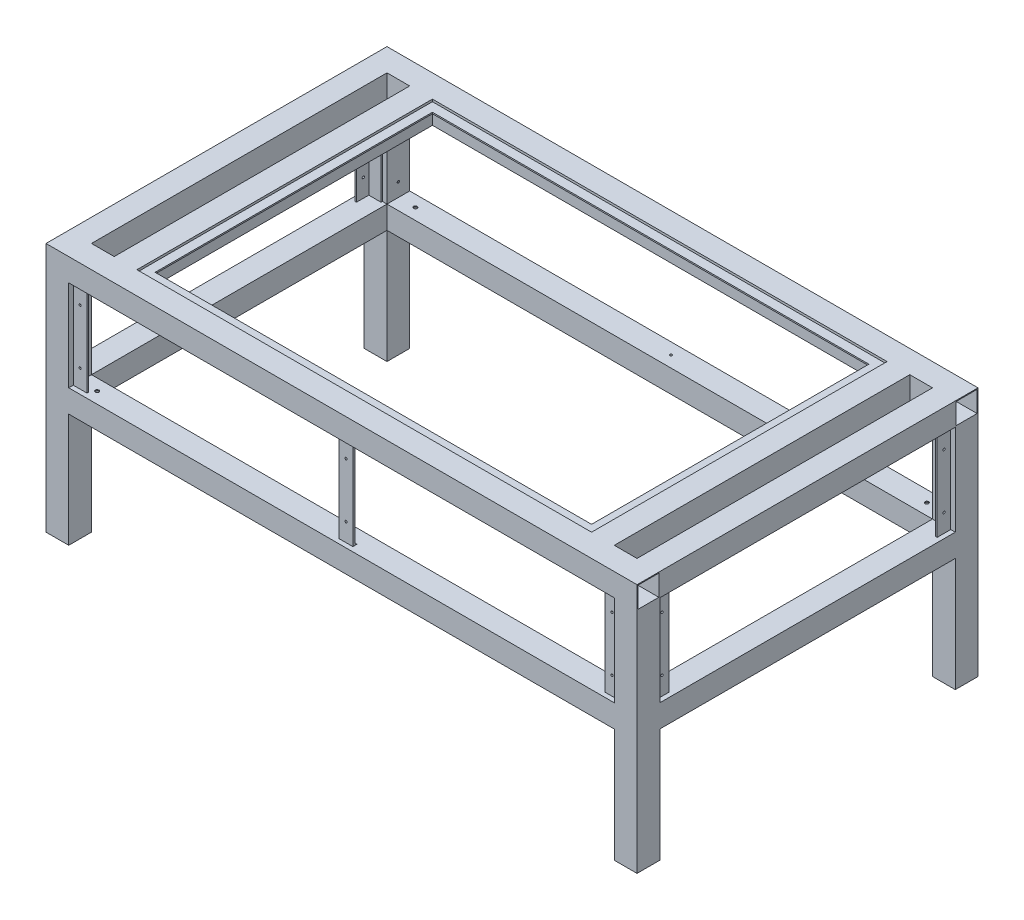
from build123d import *

# Parameters (mm, degrees)
ESQUISSE1_W               = 1300
ESQUISSE1_H               = 750
ESQUISSE1_W_2             = 1200
ESQUISSE1_H_2             = 650
BOSS_EXTRU_1_DEPTH        = 550
ESQUISSE2_W               = 1200
ESQUISSE2_H               = 200
ESQUISSE2_H_2             = 250
ENL_V_MAT_EXTRU_1_DEPTH   = 1599.436736315
ESQUISSE3_W               = 650
ESQUISSE3_H               = 200
ESQUISSE3_H_2             = 250
ENL_V_MAT_EXTRU_2_DEPTH   = 1599.436736315
ESQUISSE4_W               = 50
ESQUISSE4_H               = 650
BOSS_EXTRU_2_DEPTH        = 50
BOSS_EXTRU_2_2_DEPTH      = 50
ESQUISSE18_R              = 4
ENL_V_MAT_EXTRU_5_DEPTH   = 80
ESQUISSE19_R              = 15
ENL_V_MAT_EXTRU_6_DEPTH   = 48
ESQUISSE20_W              = 46
ESQUISSE20_H              = 46
ENL_V_MAT_EXTRU_7_DEPTH   = 10000
ESQUISSE21_W              = 46
ESQUISSE21_H              = 46
ENL_V_MAT_EXTRU_8_DEPTH   = 500
ESQUISSE22_W              = 30
ESQUISSE22_H              = 200
BOSS_EXTRU_11_DEPTH       = 3
ESQUISSE23_W              = 30
ESQUISSE23_H              = 200
ESQUISSE23_R              = 2.5
BOSS_EXTRU_12_DEPTH       = 3
SYM_TRIE2_COPY_1_SKETCH_W = 30
SYM_TRIE2_COPY_1_SKETCH_H = 200
SYM_TRIE2_COPY_1_DEPTH    = 3
SYM_TRIE2_COPY_2_SKETCH_W = 30
SYM_TRIE2_COPY_2_SKETCH_H = 200
SYM_TRIE2_COPY_2_SKETCH_R = 2.5
SYM_TRIE2_COPY_2_DEPTH    = 3
SYM_TRIE2_COPY_3_SKETCH_W = 30
SYM_TRIE2_COPY_3_SKETCH_H = 200
SYM_TRIE2_COPY_3_DEPTH    = 3
SYM_TRIE2_COPY_4_SKETCH_W = 30
SYM_TRIE2_COPY_4_SKETCH_H = 200
SYM_TRIE2_COPY_4_SKETCH_R = 2.5
SYM_TRIE2_COPY_4_DEPTH    = 3
ESQUISSE25_W              = 1000
ESQUISSE25_H              = 20
BOSS_EXTRU_14_DEPTH       = 3
ESQUISSE26_W              = 1000
ESQUISSE26_H              = 20
BOSS_EXTRU_15_DEPTH       = 3
ESQUISSE27_W              = 650
ESQUISSE27_H              = 20
BOSS_EXTRU_16_DEPTH       = 3
ESQUISSE28_W              = 20
ESQUISSE28_H              = 650
BOSS_EXTRU_17_DEPTH       = 3
SYM_TRIE8_COPY_1_SKETCH_W = 30
SYM_TRIE8_COPY_1_SKETCH_H = 200
SYM_TRIE8_COPY_1_DEPTH    = 3
SYM_TRIE8_COPY_2_SKETCH_W = 30
SYM_TRIE8_COPY_2_SKETCH_H = 200
SYM_TRIE8_COPY_2_SKETCH_R = 2.5
SYM_TRIE8_COPY_2_DEPTH    = 3
SYM_TRIE8_COPY_3_SKETCH_W = 30
SYM_TRIE8_COPY_3_SKETCH_H = 200
SYM_TRIE8_COPY_3_DEPTH    = 3
SYM_TRIE8_COPY_4_SKETCH_W = 30
SYM_TRIE8_COPY_4_SKETCH_H = 200
SYM_TRIE8_COPY_4_SKETCH_R = 2.5
SYM_TRIE8_COPY_4_DEPTH    = 3
ESQUISSE29_R              = 2.5
ENL_V_MAT_EXTRU_9_DEPTH   = 10
ESQUISSE30_R              = 2.5
ENL_V_MAT_EXTRU_10_DEPTH  = 15
ESQUISSE31_W              = 30
ESQUISSE31_H              = 5
BOSS_EXTRU_18_DEPTH       = 200
CONG_1_R                  = 5
ESQUISSE32_R              = 2.5
ENL_V_MAT_EXTRU_11_DEPTH  = 5


with BuildPart() as part:
    # Esquisse1 → Boss.-Extru.1 (new body)
    with BuildSketch(Plane(origin=(0, 0, 0), x_dir=(1, 0, 0), z_dir=(0, 1, 0))):
        with Locations((650, 375)):
            Rectangle(ESQUISSE1_W, ESQUISSE1_H)
        with Locations((650, 375)):
            Rectangle(ESQUISSE1_W_2, ESQUISSE1_H_2, mode=Mode.SUBTRACT)
    extrude(amount=-BOSS_EXTRU_1_DEPTH)

    # Esquisse2 → Enlèv. mat.-Extru.1 (cut, through all)
    with BuildSketch(Plane.XY):
        with Locations((650, -150)):
            Rectangle(ESQUISSE2_W, ESQUISSE2_H)
        with Locations((650, -425)):
            Rectangle(ESQUISSE2_W, ESQUISSE2_H_2)
    extrude(amount=-ENL_V_MAT_EXTRU_1_DEPTH, mode=Mode.SUBTRACT)

    # Esquisse3 → Enlèv. mat.-Extru.2 (cut, through all)
    with BuildSketch(Plane.ZY):
        with Locations((-375, -150)):
            Rectangle(ESQUISSE3_W, ESQUISSE3_H)
        with Locations((-375, -425)):
            Rectangle(ESQUISSE3_W, ESQUISSE3_H_2)
    extrude(amount=-ENL_V_MAT_EXTRU_2_DEPTH, mode=Mode.SUBTRACT)

    # Esquisse18 → Enlèv. mat.-Extru.5 (cut)
    with BuildSketch(Plane(origin=(0, -250, 0), x_dir=(1, 0, 0), z_dir=(0, 1, 0))):
        with Locations((1212.5, 25)):
            Circle(ESQUISSE18_R)
        with Locations((87.5, 25)):
            Circle(ESQUISSE18_R)
        with Locations((87.5, 725)):
            Circle(ESQUISSE18_R)
        with Locations((1212.5, 725)):
            Circle(ESQUISSE18_R)
    extrude(amount=-ENL_V_MAT_EXTRU_5_DEPTH, mode=Mode.SUBTRACT)

    # Esquisse19 → Enlèv. mat.-Extru.6 (cut)
    with BuildSketch(Plane(origin=(0, -300, 0), x_dir=(-1, 0, 0), z_dir=(0, -1, 0))):
        with Locations((-1212.5, 725)):
            Circle(ESQUISSE19_R)
        with Locations((-87.5, 725)):
            Circle(ESQUISSE19_R)
        with Locations((-87.5, 25)):
            Circle(ESQUISSE19_R)
        with Locations((-1212.5, 25)):
            Circle(ESQUISSE19_R)
    extrude(amount=-ENL_V_MAT_EXTRU_6_DEPTH, mode=Mode.SUBTRACT)

    # Esquisse20 → Enlèv. mat.-Extru.7 (cut)
    with BuildSketch(Plane.ZY):
        with Locations((-25, -25)):
            Rectangle(ESQUISSE20_W, ESQUISSE20_H)
        with Locations((-725, -25)):
            Rectangle(ESQUISSE20_W, ESQUISSE20_H)
    extrude(amount=-ENL_V_MAT_EXTRU_7_DEPTH, mode=Mode.SUBTRACT)

    # Esquisse21 → Enlèv. mat.-Extru.8 (cut)
    with BuildSketch(Plane(origin=(0, -550, 0), x_dir=(-1, 0, 0), z_dir=(0, -1, 0))):
        with Locations((-1275, 25)):
            Rectangle(ESQUISSE21_W, ESQUISSE21_H)
        with Locations((-1275, 725)):
            Rectangle(ESQUISSE21_W, ESQUISSE21_H)
        with Locations((-25, 725)):
            Rectangle(ESQUISSE21_W, ESQUISSE21_H)
        with Locations((-25, 25)):
            Rectangle(ESQUISSE21_W, ESQUISSE21_H)
    extrude(amount=-ENL_V_MAT_EXTRU_8_DEPTH, mode=Mode.SUBTRACT)

    # Esquisse22 → Boss.-Extru.11 (add)
    with BuildSketch(Plane(origin=(0, 0, -50), x_dir=(-1, 0, 0), z_dir=(0, 0, -1))):
        with Locations((-25, -150)):
            Rectangle(ESQUISSE22_W, ESQUISSE22_H)
    boss_extru_11 = extrude(amount=BOSS_EXTRU_11_DEPTH)

    # Esquisse23 → Boss.-Extru.12 (add)
    with BuildSketch(Plane.ZY.offset(-10)):
        with Locations((-65, -150)):
            Rectangle(ESQUISSE23_W, ESQUISSE23_H)
        with Locations((-65, -90)):
            Circle(ESQUISSE23_R, mode=Mode.SUBTRACT)
        with Locations((-65, -210)):
            Circle(ESQUISSE23_R, mode=Mode.SUBTRACT)
    boss_extru_12 = extrude(amount=-BOSS_EXTRU_12_DEPTH)

    # Symétrie1: Boss.-Extru.11, Boss.-Extru.12 across plane
    add(boss_extru_11.mirror(Plane.XY.offset(-375)))
    add(boss_extru_12.mirror(Plane.XY.offset(-375)))

    # Symétrie2 copy 1 sketch → Symétrie2 copy 1 (add)
    with BuildSketch(Plane(origin=(1300, 0, -700), x_dir=(1, 0, 0), z_dir=(0, 0, 1))):
        with Locations((-25, -150)):
            Rectangle(SYM_TRIE2_COPY_1_SKETCH_W, SYM_TRIE2_COPY_1_SKETCH_H)
    extrude(amount=SYM_TRIE2_COPY_1_DEPTH)

    # Symétrie2 copy 2 sketch → Symétrie2 copy 2 (add)
    with BuildSketch(Plane(origin=(1290, 0, -750), x_dir=(0, 0, -1), z_dir=(1, 0, 0))):
        with Locations((-65, -150)):
            Rectangle(SYM_TRIE2_COPY_2_SKETCH_W, SYM_TRIE2_COPY_2_SKETCH_H)
        with Locations((-65, -90)):
            Circle(SYM_TRIE2_COPY_2_SKETCH_R, mode=Mode.SUBTRACT)
        with Locations((-65, -210)):
            Circle(SYM_TRIE2_COPY_2_SKETCH_R, mode=Mode.SUBTRACT)
    extrude(amount=-SYM_TRIE2_COPY_2_DEPTH)

    # Symétrie2 copy 3 sketch → Symétrie2 copy 3 (add)
    with BuildSketch(Plane(origin=(1300, 0, -50), x_dir=(1, 0, 0), z_dir=(0, 0, -1))):
        with Locations((-25, 150)):
            Rectangle(SYM_TRIE2_COPY_3_SKETCH_W, SYM_TRIE2_COPY_3_SKETCH_H)
    extrude(amount=SYM_TRIE2_COPY_3_DEPTH)

    # Symétrie2 copy 4 sketch → Symétrie2 copy 4 (add)
    with BuildSketch(Plane(origin=(1290, 0, 0), x_dir=(0, 0, 1), z_dir=(1, 0, 0))):
        with Locations((-65, 150)):
            Rectangle(SYM_TRIE2_COPY_4_SKETCH_W, SYM_TRIE2_COPY_4_SKETCH_H)
        with Locations((-65, 90)):
            Circle(SYM_TRIE2_COPY_4_SKETCH_R, mode=Mode.SUBTRACT)
        with Locations((-65, 210)):
            Circle(SYM_TRIE2_COPY_4_SKETCH_R, mode=Mode.SUBTRACT)
    extrude(amount=-SYM_TRIE2_COPY_4_DEPTH)

    # Symétrie3: Boss.-Extru.11, Boss.-Extru.12 across plane
    add(boss_extru_11.mirror(Plane(origin=(0, 0, 0), x_dir=(-0.7071067811865475, 0, 0.7071067811865477), z_dir=(-0.7071067811865476, 0, -0.7071067811865475))))
    add(boss_extru_12.mirror(Plane(origin=(0, 0, 0), x_dir=(-0.7071067811865475, 0, 0.7071067811865477), z_dir=(-0.7071067811865476, 0, -0.7071067811865475))))



with BuildPart() as body_2:
    # Esquisse4 → Boss.-Extru.2 (new body)
    with BuildSketch(Plane(origin=(0, 0, 0), x_dir=(1, 0, 0), z_dir=(0, 1, 0))):
        with Locations((125, 375)):
            Rectangle(ESQUISSE4_W, ESQUISSE4_H)
    extrude(amount=-BOSS_EXTRU_2_DEPTH)


with BuildPart() as body_3:
    # Esquisse4 → Boss.-Extru.2 2 (new body)
    with BuildSketch(Plane(origin=(0, 0, 0), x_dir=(1, 0, 0), z_dir=(0, 1, 0))):
        with Locations((1175, 375)):
            Rectangle(ESQUISSE4_W, ESQUISSE4_H)
    extrude(amount=-BOSS_EXTRU_2_2_DEPTH)


with BuildPart() as part_1:
    add(part.part)

    add(body_2.part)  # Boss.-Extru.14 merges body 2

    add(body_3.part)  # Boss.-Extru.14 merges body 3
    # Esquisse25 → Boss.-Extru.14 (add)
    with BuildSketch(Plane(origin=(0, 0, -50), x_dir=(-1, 0, 0), z_dir=(0, 0, -1))):
        with Locations((-650, -15)):
            Rectangle(ESQUISSE25_W, ESQUISSE25_H)
    boss_extru_14 = extrude(amount=BOSS_EXTRU_14_DEPTH)

    # Esquisse26 → Boss.-Extru.15 (add)
    with BuildSketch(Plane(origin=(0, -5, 0), x_dir=(1, 0, 0), z_dir=(0, 1, 0))):
        with Locations((650, 60)):
            Rectangle(ESQUISSE26_W, ESQUISSE26_H)
    boss_extru_15 = extrude(amount=-BOSS_EXTRU_15_DEPTH)

    # Symétrie6: Boss.-Extru.14, Boss.-Extru.15 across plane
    add(boss_extru_14.mirror(Plane.XY.offset(-375)))
    add(boss_extru_15.mirror(Plane.XY.offset(-375)))

    # Esquisse27 → Boss.-Extru.16 (add)
    with BuildSketch(Plane.ZY.offset(-1150)):
        with Locations((-375, -15)):
            Rectangle(ESQUISSE27_W, ESQUISSE27_H)
    boss_extru_16 = extrude(amount=BOSS_EXTRU_16_DEPTH)

    # Esquisse28 → Boss.-Extru.17 (add)
    with BuildSketch(Plane(origin=(0, -5, 0), x_dir=(1, 0, 0), z_dir=(0, 1, 0))):
        with Locations((1140, 375)):
            Rectangle(ESQUISSE28_W, ESQUISSE28_H)
    boss_extru_17 = extrude(amount=-BOSS_EXTRU_17_DEPTH)

    # Symétrie7: Boss.-Extru.16, Boss.-Extru.17 across plane
    add(boss_extru_16.mirror(Plane.ZY.offset(-650)))
    add(boss_extru_17.mirror(Plane.ZY.offset(-650)))

    # Symétrie8 copy 1 sketch → Symétrie8 copy 1 (add)
    with BuildSketch(Plane.ZY.offset(-1250)):
        with Locations((-25, -150)):
            Rectangle(SYM_TRIE8_COPY_1_SKETCH_W, SYM_TRIE8_COPY_1_SKETCH_H)
    extrude(amount=SYM_TRIE8_COPY_1_DEPTH)

    # Symétrie8 copy 2 sketch → Symétrie8 copy 2 (add)
    with BuildSketch(Plane(origin=(1300, 0, -10), x_dir=(1, 0, 0), z_dir=(0, 0, 1))):
        with Locations((-65, -150)):
            Rectangle(SYM_TRIE8_COPY_2_SKETCH_W, SYM_TRIE8_COPY_2_SKETCH_H)
        with Locations((-65, -90)):
            Circle(SYM_TRIE8_COPY_2_SKETCH_R, mode=Mode.SUBTRACT)
        with Locations((-65, -210)):
            Circle(SYM_TRIE8_COPY_2_SKETCH_R, mode=Mode.SUBTRACT)
    extrude(amount=-SYM_TRIE8_COPY_2_DEPTH)

    # Symétrie8 copy 3 sketch → Symétrie8 copy 3 (add)
    with BuildSketch(Plane(origin=(1300, 0, -50), x_dir=(1, 0, 0), z_dir=(0, 0, -1))):
        with Locations((-25, 150)):
            Rectangle(SYM_TRIE8_COPY_3_SKETCH_W, SYM_TRIE8_COPY_3_SKETCH_H)
    extrude(amount=SYM_TRIE8_COPY_3_DEPTH)

    # Symétrie8 copy 4 sketch → Symétrie8 copy 4 (add)
    with BuildSketch(Plane(origin=(1290, 0, 0), x_dir=(0, 0, 1), z_dir=(1, 0, 0))):
        with Locations((-65, 150)):
            Rectangle(SYM_TRIE8_COPY_4_SKETCH_W, SYM_TRIE8_COPY_4_SKETCH_H)
        with Locations((-65, 90)):
            Circle(SYM_TRIE8_COPY_4_SKETCH_R, mode=Mode.SUBTRACT)
        with Locations((-65, 210)):
            Circle(SYM_TRIE8_COPY_4_SKETCH_R, mode=Mode.SUBTRACT)
    extrude(amount=-SYM_TRIE8_COPY_4_DEPTH)

    # Esquisse29 → Enlèv. mat.-Extru.9 (cut)
    with BuildSketch(Plane.ZY.offset(-1250)):
        with Locations((-725, -220)):
            Circle(ESQUISSE29_R)
        with Locations((-725, -80)):
            Circle(ESQUISSE29_R)
    enl_v_mat_extru_9 = extrude(amount=-ENL_V_MAT_EXTRU_9_DEPTH, mode=Mode.SUBTRACT)

    # Symétrie9: Enlèv. mat.-Extru.9 across plane
    add(enl_v_mat_extru_9.mirror(Plane.ZY.offset(-650)), mode=Mode.SUBTRACT)

    # Esquisse30 → Enlèv. mat.-Extru.10 (cut)
    with BuildSketch(Plane(origin=(0, -250, 0), x_dir=(1, 0, 0), z_dir=(0, 1, 0))):
        with Locations((650, 725)):
            Circle(ESQUISSE30_R)
    enl_v_mat_extru_10 = extrude(amount=-ENL_V_MAT_EXTRU_10_DEPTH, mode=Mode.SUBTRACT)

    # Symétrie10: Enlèv. mat.-Extru.10 across plane
    add(enl_v_mat_extru_10.mirror(Plane(origin=(0, -150, 0), x_dir=(0, 0, 1), z_dir=(0, -1, 0))), mode=Mode.SUBTRACT)

    # Esquisse31 → Boss.-Extru.18 (add)
    with BuildSketch(Plane(origin=(0, -250, 0), x_dir=(1, 0, 0), z_dir=(0, 1, 0))):
        with Locations((650, 12.5)):
            Rectangle(ESQUISSE31_W, ESQUISSE31_H)
    extrude(amount=BOSS_EXTRU_18_DEPTH)

    # Congé1
    cong_1_edges = [part_1.edges().sort_by_distance(p)[0] for p in [
        (650, -250, -15),
        (650, -50, -15),
    ]]
    fillet(cong_1_edges, radius=CONG_1_R)

    # Esquisse32 → Enlèv. mat.-Extru.11 (cut)
    with BuildSketch(Plane.XY.offset(-10)):
        with Locations((650, -210)):
            Circle(ESQUISSE32_R)
        with Locations((650, -90)):
            Circle(ESQUISSE32_R)
    extrude(amount=-ENL_V_MAT_EXTRU_11_DEPTH, mode=Mode.SUBTRACT)


solid = part_1.part
